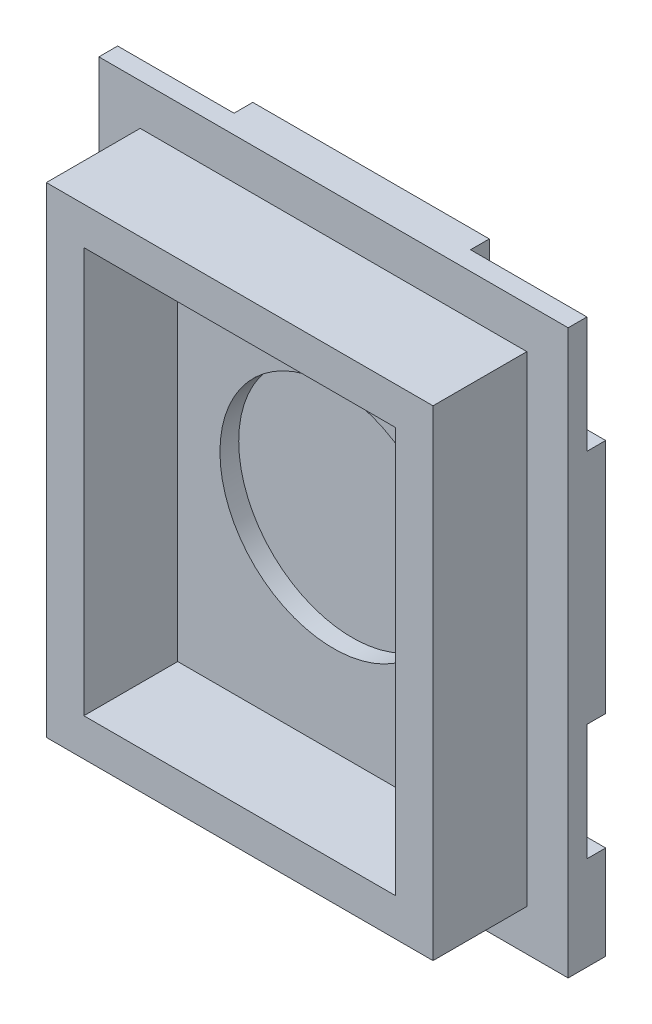
from build123d import *

# Parameters (mm, degrees)
SKETCH_1_W          = 25
SKETCH_1_H          = 30
EXTRUDE_1_DEPTH     = 2
SKETCH_2_W          = 20.6
SKETCH_2_H          = 25.6
EXTRUDE_2_DEPTH     = 5
SKETCH_3_W          = 16.6
SKETCH_3_H          = 21.6
CUT_EXTRUDE_1_DEPTH = 5
SKETCH_4_W          = 6.2
SKETCH_4_H          = 6.2
CUT_EXTRUDE_2_DEPTH = 1
SKETCH_5_R          = 6.05
CUT_EXTRUDE_3_DEPTH = 1


with BuildPart() as part:
    # ｽｹｯﾁ1 → ﾎﾞｽ - 押し出し1 (new body)
    with BuildSketch(Plane.XY):
        with Locations((-24.237274581, 24.707142857)):
            Rectangle(SKETCH_1_W, SKETCH_1_H)
    extrude(amount=EXTRUDE_1_DEPTH)

    # ｽｹｯﾁ2 → ﾎﾞｽ - 押し出し2 (add)
    with BuildSketch(Plane.XY.offset(2)):
        with Locations((-24.237274581, 24.707142857)):
            Rectangle(SKETCH_2_W, SKETCH_2_H)
    extrude(amount=EXTRUDE_2_DEPTH)

    # ｽｹｯﾁ3 → ｶｯﾄ - 押し出し1 (cut)
    with BuildSketch(Plane.XY.offset(7)):
        with Locations((-24.237274581, 24.707142857)):
            Rectangle(SKETCH_3_W, SKETCH_3_H)
    extrude(amount=-CUT_EXTRUDE_1_DEPTH, mode=Mode.SUBTRACT)

    # ｽｹｯﾁ4 → ｶｯﾄ - 押し出し2 (cut)
    with BuildSketch(Plane(origin=(0, 0, 0), x_dir=(-1, 0, 0), z_dir=(0, 0, -1))):
        with Locations((14.837274581, 36.607142857)):
            Rectangle(SKETCH_4_W, SKETCH_4_H)
        with Locations((33.637274581, 36.607142857)):
            Rectangle(SKETCH_4_W, SKETCH_4_H)
        with Locations((34.637274581, 17.807142857)):
            Rectangle(SKETCH_4_W, SKETCH_4_H)
        with Locations((14.837274581, 17.807142857)):
            Rectangle(SKETCH_4_W, SKETCH_4_H)
    extrude(amount=-CUT_EXTRUDE_2_DEPTH, mode=Mode.SUBTRACT)

    # ｽｹｯﾁ5 → ｶｯﾄ - 押し出し3 (cut)
    with BuildSketch(Plane.XY.offset(2)):
        with Locations((-24.237274581, 24.707142857)):
            Circle(SKETCH_5_R)
    extrude(amount=-CUT_EXTRUDE_3_DEPTH, mode=Mode.SUBTRACT)


solid = part.part
